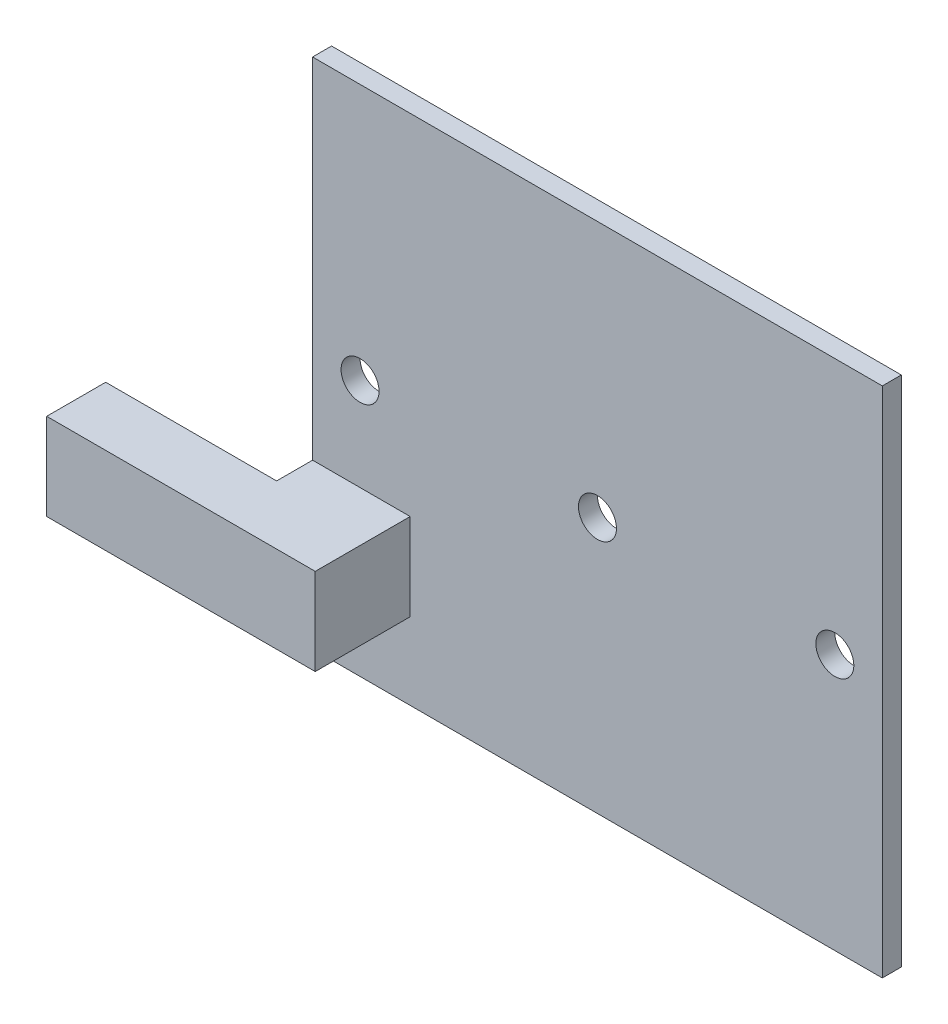
from build123d import *

# Parameters (mm, degrees)
ESQUISSE1_W        = 60
ESQUISSE1_H        = 54
ESQUISSE1_R        = 2
BOSS_EXTRU_1_DEPTH = 2
ESQUISSE2_W        = 10.280509859
ESQUISSE2_H        = 9.141167947
BOSS_EXTRU_2_DEPTH = 10
ESQUISSE3_W        = 6.213740386
ESQUISSE3_H        = 9.141167947
BOSS_EXTRU_3_DEPTH = 18


with BuildPart() as part:
    # Esquisse1 → Boss.-Extru.1 (new body)
    with BuildSketch(Plane.XY):
        with Locations((30, -27)):
            Rectangle(ESQUISSE1_W, ESQUISSE1_H)
        with Locations((5, -27)):
            Circle(ESQUISSE1_R, mode=Mode.SUBTRACT)
        with Locations((30, -27)):
            Circle(ESQUISSE1_R, mode=Mode.SUBTRACT)
        with Locations((55, -27)):
            Circle(ESQUISSE1_R, mode=Mode.SUBTRACT)
    extrude(amount=BOSS_EXTRU_1_DEPTH)

    # Esquisse2 → Boss.-Extru.2 (add)
    with BuildSketch(Plane.XY.offset(2)):
        with Locations((5.14025493, -41.342910944)):
            Rectangle(ESQUISSE2_W, ESQUISSE2_H)
    extrude(amount=BOSS_EXTRU_2_DEPTH)

    # Esquisse3 → Boss.-Extru.3 (add)
    with BuildSketch(Plane.ZY):
        with Locations((8.893129807, -41.342910944)):
            Rectangle(ESQUISSE3_W, ESQUISSE3_H)
    extrude(amount=BOSS_EXTRU_3_DEPTH)


solid = part.part
